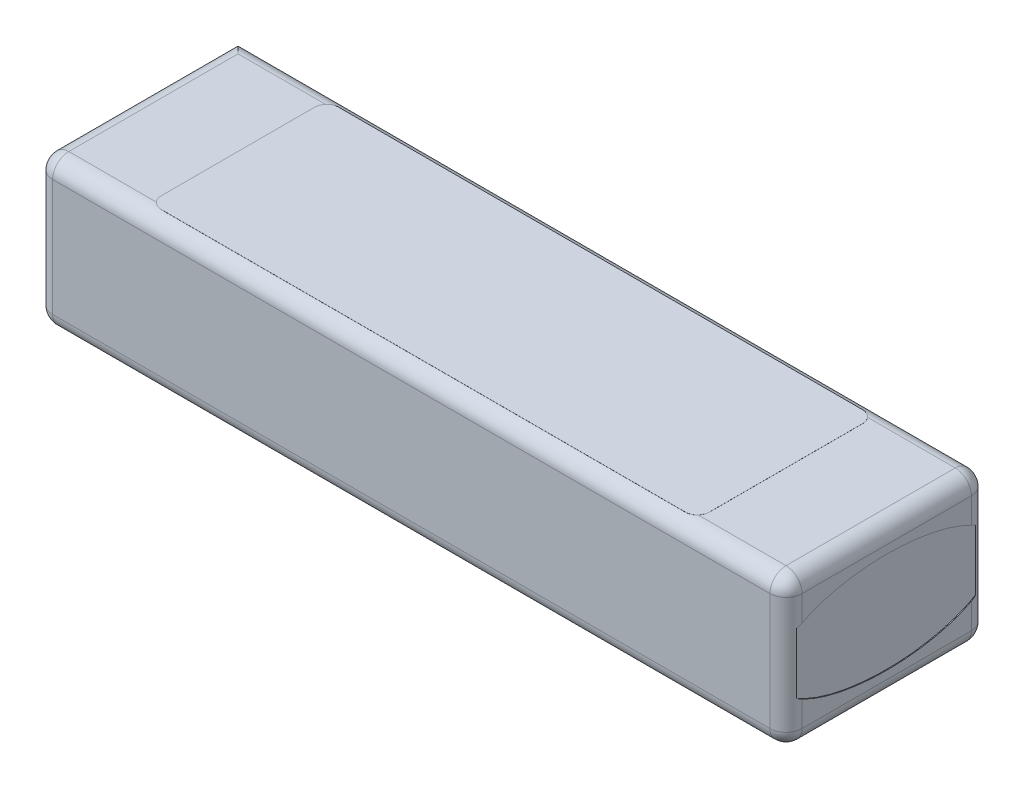
from build123d import *

# Parameters (mm, degrees)
SKETCH1_W           = 93
SKETCH1_H           = 25
BOSS_EXTRUDE1_DEPTH = 18.5
FILLET1_R           = 2
FILLET2_R           = 2
BOSS_EXTRUDE2_DEPTH = 0.01
SKETCH4_RX          = 13.895867653
SKETCH4_RY          = 6.24610939
CUT_EXTRUDE1_DEPTH  = 0.1
SKETCH5_RX          = 21.704276093
SKETCH5_RY          = 7.058205551
CUT_EXTRUDE2_DEPTH  = 0.1


with BuildPart() as part:
    # Sketch1 → Boss-Extrude1 (new body)
    with BuildSketch(Plane(origin=(0, 0, 0), x_dir=(1, 0, 0), z_dir=(0, 1, 0))):
        Rectangle(SKETCH1_W, SKETCH1_H)
    extrude(amount=BOSS_EXTRUDE1_DEPTH)

    # Fillet1
    fillet1_edges = [part.edges().sort_by_distance(p)[0] for p in [
        (-46.5, 18.5, 0),
        (46.5, 18.5, 0),
        (-46.5, 0, 0),
        (46.5, 0, 0),
    ]]
    fillet(fillet1_edges, radius=FILLET1_R)

    # Fillet2
    # the kernel refuses this fillet: 2 mm, written as the material it takes off along each edge
    with BuildSketch(Plane(origin=(-49.5, 18.5, -12.5), x_dir=(0, -1, 0), z_dir=(1, 0, 0))) as fillet2_piece_1:
        with BuildLine():
            CenterArc((FILLET2_R, -FILLET2_R), FILLET2_R, 90, 90)
            Line((0, -FILLET2_R), (0, 0))
            Line((0, 0), (FILLET2_R, 0))
        make_face()
    extrude(amount=94, mode=Mode.SUBTRACT)
    with BuildSketch(Plane(origin=(44.5, 18.5, 12.5), x_dir=(0, 0, -1), z_dir=(-1, 0, 0))) as fillet2_piece_2:
        with BuildLine():
            CenterArc((FILLET2_R, FILLET2_R), FILLET2_R, 180, 90)
            Line((0, FILLET2_R), (0, 0))
            Line((0, 0), (FILLET2_R, 0))
        make_face()
    extrude(amount=89, mode=Mode.SUBTRACT)
    with BuildSketch(Plane(origin=(44.5, 0, 12.5), x_dir=(0, 0, -1), z_dir=(-1, 0, 0))) as fillet2_piece_3:
        with BuildLine():
            CenterArc((FILLET2_R, -FILLET2_R), FILLET2_R, 90, 90)
            Line((0, -FILLET2_R), (0, 0))
            Line((0, 0), (FILLET2_R, 0))
        make_face()
    extrude(amount=89, mode=Mode.SUBTRACT)
    with BuildSketch(Plane(origin=(46.5, 2, 12.5), x_dir=(0, 0, -1), z_dir=(0, 1, 0)), Plane(origin=(46.5, 2, -12.5), x_dir=(-1, 0, 0), z_dir=(0, 1, 0))) as fillet2_piece_4:
        with BuildLine():
            CenterArc((FILLET2_R, FILLET2_R), FILLET2_R, 180, 90)
            Line((0, FILLET2_R), (0, 0))
            Line((0, 0), (FILLET2_R, 0))
        make_face()
    extrude(amount=14.5, mode=Mode.SUBTRACT)
    with BuildSketch(Plane(origin=(-46.5, 2, 12.5), x_dir=(0, 0, -1), z_dir=(0, 1, 0))) as fillet2_piece_5:
        with BuildLine():
            CenterArc((FILLET2_R, -FILLET2_R), FILLET2_R, 90, 90)
            Line((0, -FILLET2_R), (0, 0))
            Line((0, 0), (FILLET2_R, 0))
        make_face()
    extrude(amount=14.5, mode=Mode.SUBTRACT)
    with BuildSketch(Plane(origin=(44.5, 16.5, 12.5), x_dir=(1, 0, 0), z_dir=(0, -1, 0))) as fillet2_piece_6:
        with BuildLine():
            CenterArc((2 - FILLET2_R, -FILLET2_R), FILLET2_R, 0, 90)
            Line((2 - FILLET2_R, 0), (2, 0))
            Line((2, 0), (2, -FILLET2_R))
        make_face()
    revolve(axis=Axis((44.5, 16.5, 12.5), (0, 0, 1)), revolution_arc=90, mode=Mode.SUBTRACT)
    with BuildSketch(Plane(origin=(44.5, 2, 12.5), x_dir=(1, 0, 0), z_dir=(0, 1, 0))) as fillet2_piece_7:
        with BuildLine():
            CenterArc((2 - FILLET2_R, FILLET2_R), FILLET2_R, 270, 90)
            Line((2 - FILLET2_R, 0), (2, 0))
            Line((2, 0), (2, FILLET2_R))
        make_face()
    revolve(axis=Axis((44.5, 2, 12.5), (0, 0, -1)), revolution_arc=90, mode=Mode.SUBTRACT)
    with BuildSketch(Plane(origin=(-44.5, 2, 12.5), x_dir=(-1, 0, 0), z_dir=(0, 1, 0))) as fillet2_piece_8:
        with BuildLine():
            CenterArc((2 - FILLET2_R, -FILLET2_R), FILLET2_R, 0, 90)
            Line((2 - FILLET2_R, 0), (2, 0))
            Line((2, 0), (2, -FILLET2_R))
        make_face()
    revolve(axis=Axis((-44.5, 2, 12.5), (0, 0, 1)), revolution_arc=90, mode=Mode.SUBTRACT)
    with BuildSketch(Plane(origin=(-44.5, 16.5, 12.5), x_dir=(-1, 0, 0), z_dir=(0, -1, 0))) as fillet2_piece_9:
        with BuildLine():
            CenterArc((2 - FILLET2_R, FILLET2_R), FILLET2_R, 270, 90)
            Line((2 - FILLET2_R, 0), (2, 0))
            Line((2, 0), (2, FILLET2_R))
        make_face()
    revolve(axis=Axis((-44.5, 16.5, 12.5), (0, 0, -1)), revolution_arc=90, mode=Mode.SUBTRACT)
    with BuildSketch(Plane(origin=(-49.5, 0, -12.5), x_dir=(0, 1, 0), z_dir=(1, 0, 0))) as fillet2_piece_10:
        with BuildLine():
            CenterArc((FILLET2_R, FILLET2_R), FILLET2_R, 180, 90)
            Line((0, FILLET2_R), (0, 0))
            Line((0, 0), (FILLET2_R, 0))
        make_face()
    extrude(amount=94, mode=Mode.SUBTRACT)
    with BuildSketch(Plane(origin=(44.5, 16.5, -12.5), x_dir=(1, 0, 0), z_dir=(0, -1, 0))) as fillet2_piece_11:
        with BuildLine():
            CenterArc((2 - FILLET2_R, FILLET2_R), FILLET2_R, 270, 90)
            Line((2, FILLET2_R), (2, 0))
            Line((2, 0), (2 - FILLET2_R, 0))
        make_face()
    revolve(axis=Axis((44.5, 16.5, -12.5), (0, 0, 1)), revolution_arc=90, mode=Mode.SUBTRACT)
    with BuildSketch(Plane(origin=(44.5, 2, -12.5), x_dir=(1, 0, 0), z_dir=(0, 1, 0))) as fillet2_piece_12:
        with BuildLine():
            CenterArc((2 - FILLET2_R, -FILLET2_R), FILLET2_R, 0, 90)
            Line((2, -FILLET2_R), (2, 0))
            Line((2, 0), (2 - FILLET2_R, 0))
        make_face()
    revolve(axis=Axis((44.5, 2, -12.5), (0, 0, -1)), revolution_arc=90, mode=Mode.SUBTRACT)

    # Sketch3 → Boss-Extrude2 (add)
    with BuildSketch(Plane(origin=(0, 18.5, 0), x_dir=(-1, 0, 0), z_dir=(0, 1, 0))):
        with BuildLine():
            Line((-32.5, 11), (32.5, 11))
            ThreePointArc((32.5, 11), (33.560660172, 10.560660172), (34, 9.5))
            Line((34, 9.5), (34, -9.5))
            ThreePointArc((34, -9.5), (33.560660172, -10.560660172), (32.5, -11))
            Line((32.5, -11), (-32.5, -11))
            ThreePointArc((-32.5, -11), (-33.560660172, -10.560660172), (-34, -9.5))
            Line((-34, -9.5), (-34, 9.5))
            ThreePointArc((-34, 9.5), (-33.560660172, 10.560660172), (-32.5, 11))
        make_face()
    extrude(amount=BOSS_EXTRUDE2_DEPTH)

    # Sketch4 → Cut-Extrude1 (cut)
    with BuildSketch(Plane(origin=(46.5, 0, 0), x_dir=(0, 0, -1), z_dir=(1, 0, 0))):
        with Locations(Location((0, 9.25), (0, 0, 180))):
            Ellipse(SKETCH4_RX, SKETCH4_RY)
    extrude(amount=-CUT_EXTRUDE1_DEPTH, mode=Mode.SUBTRACT)

    # Sketch5 → Cut-Extrude2 (cut)
    with BuildSketch(Plane.ZY.offset(46.5)):
        with Locations(Location((-7.207732319, 9.25), (0, 0, 180))):
            Ellipse(SKETCH5_RX, SKETCH5_RY)
    extrude(amount=-CUT_EXTRUDE2_DEPTH, mode=Mode.SUBTRACT)


solid = part.part
